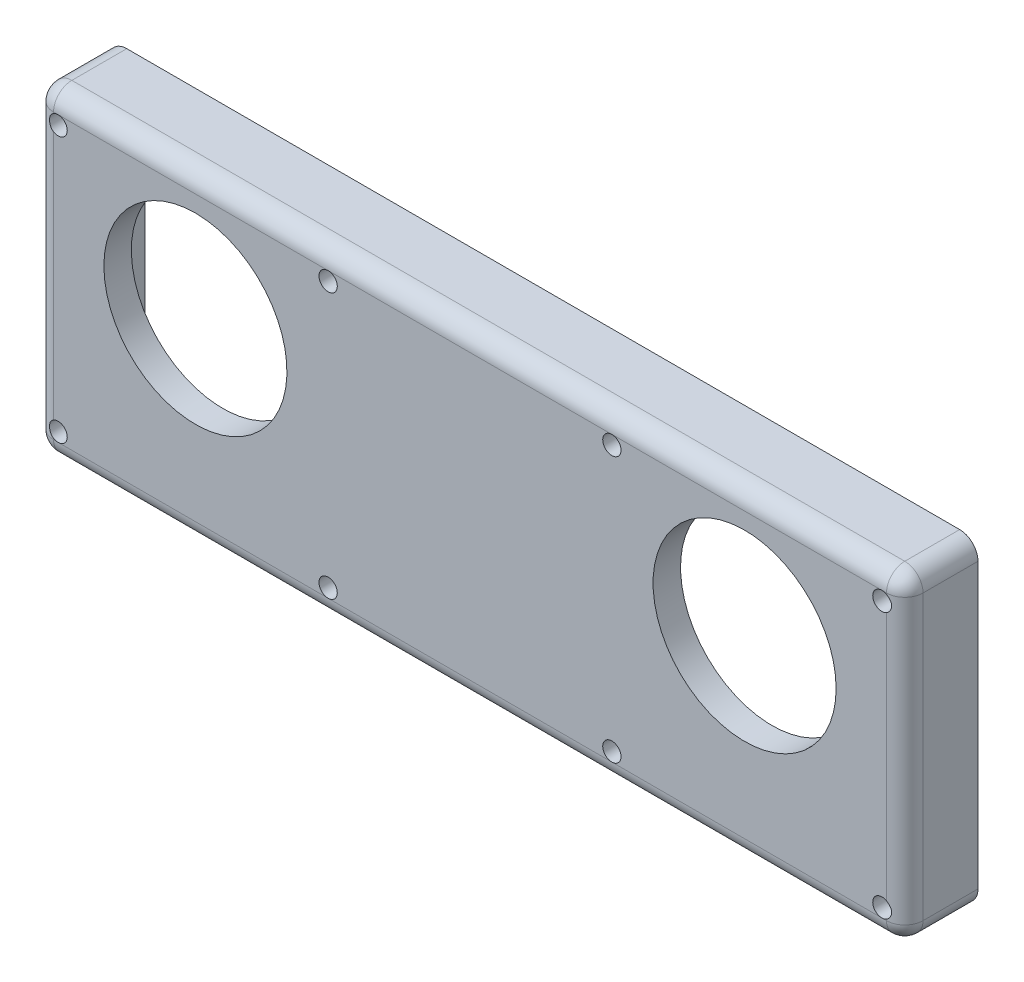
from build123d import *
from build123d.topology import SkipClean

# Parameters (mm, degrees)
SKETCH2_W           = 93
SKETCH2_H           = 32
SKETCH2_R           = 1
BOSS_EXTRUDE1_DEPTH = 3
SKETCH6_W           = 95
SKETCH6_H           = 35
SKETCH6_W_2         = 93
SKETCH6_H_2         = 32
BOSS_EXTRUDE2_DEPTH = 3
SKETCH8_W           = 95
SKETCH8_H           = 0.708642827
CUT_EXTRUDE6_DEPTH  = 10
SKETCH9_W           = 95
SKETCH9_H           = 0.71
BOSS_EXTRUDE3_DEPTH = 3
SKETCH10_R          = 10
CUT_EXTRUDE7_DEPTH  = 10
BOSS_EXTRUDE7_START = 5
SKETCH11_W          = 95
SKETCH11_H          = 35.001357173
SKETCH11_R          = 1
BOSS_EXTRUDE7_DEPTH = 5
FILLET1_R           = 2
FILLET2_R           = 2
CUT_EXTRUDE9_DEPTH  = 2


# Some blends are built 0.0001 mm under size
with BuildPart() as part:
    # Sketch2 → Boss-Extrude1 (new body)
    with BuildSketch(Plane.XY):
        with Locations((-12.642912006, 28.831434421)):
            Rectangle(SKETCH2_W, SKETCH2_H)
        with Locations((-57.642912006, 43.331434421)):
            Circle(SKETCH2_R, mode=Mode.SUBTRACT)
        with Locations((-57.642912006, 14.331434421)):
            Circle(SKETCH2_R, mode=Mode.SUBTRACT)
        with Locations((-28.142912006, 43.331434421)):
            Circle(SKETCH2_R, mode=Mode.SUBTRACT)
        with Locations((2.857087994, 43.331434421)):
            Circle(SKETCH2_R, mode=Mode.SUBTRACT)
        with Locations((2.857087994, 14.331434421)):
            Circle(SKETCH2_R, mode=Mode.SUBTRACT)
        with Locations((-28.142912006, 14.331434421)):
            Circle(SKETCH2_R, mode=Mode.SUBTRACT)
        with Locations((32.357087994, 14.331434421)):
            Circle(SKETCH2_R, mode=Mode.SUBTRACT)
        with Locations((32.357087994, 43.331434421)):
            Circle(SKETCH2_R, mode=Mode.SUBTRACT)
    extrude(amount=BOSS_EXTRUDE1_DEPTH)

    # Sketch6 → Boss-Extrude2 (add)
    with BuildSketch(Plane.XY.offset(3)):
        with Locations((-12.642912006, 29.540077248)):
            Rectangle(SKETCH6_W, SKETCH6_H)
        with Locations((-12.642912006, 28.831434421)):
            Rectangle(SKETCH6_W_2, SKETCH6_H_2, mode=Mode.SUBTRACT)
    extrude(amount=-BOSS_EXTRUDE2_DEPTH)

    # Sketch8 → Cut-Extrude6 (cut)
    with BuildSketch(Plane(origin=(0, 0, 0), x_dir=(-1, 0, 0), z_dir=(0, 0, -1))):
        with Locations((12.642912006, 46.685755835)):
            Rectangle(SKETCH8_W, SKETCH8_H)
    extrude(amount=-CUT_EXTRUDE6_DEPTH, mode=Mode.SUBTRACT)

    # Sketch9 → Boss-Extrude3 (add)
    with BuildSketch(Plane.XY.offset(3)):
        with Locations((-12.642912006, 11.685077248)):
            Rectangle(SKETCH9_W, SKETCH9_H)
    extrude(amount=-BOSS_EXTRUDE3_DEPTH)

    # Sketch10 → Cut-Extrude7 (cut)
    with BuildSketch(Plane.XY.offset(3)):
        with Locations((17.357087994, 32.531434421)):
            Circle(SKETCH10_R)
    cut_extrude7 = extrude(amount=-CUT_EXTRUDE7_DEPTH, mode=Mode.SUBTRACT)

    # Sketch11 → Boss-Extrude7 (add)
    with SkipClean():  # the faces are left unmerged after this step: merging them gives an invalid solid
        with BuildSketch(Plane(origin=(0, 0, 0), x_dir=(-1, 0, 0), z_dir=(0, 0, -1)).offset(BOSS_EXTRUDE7_START)):
            with Locations((12.642912006, 28.830755835)):
                Rectangle(SKETCH11_W, SKETCH11_H)
            with BuildLine():
                Line((-30.857087994, 41.830755835), (-21.034399682, 41.830755835))
                ThreePointArc((-21.034399682, 41.830755835), (-17.357087994, 42.531434421), (-13.679776305, 41.830755835))
                Line((-13.679776305, 41.830755835), (56.142912006, 41.830755835))
                Line((56.142912006, 41.830755835), (56.142912006, 15.830755835))
                Line((56.142912006, 15.830755835), (-30.857087994, 15.830755835))
                Line((-30.857087994, 15.830755835), (-30.857087994, 41.830755835))
            make_face(mode=Mode.SUBTRACT)
            with Locations((-32.357087994, 14.331434421)):
                Circle(SKETCH11_R, mode=Mode.SUBTRACT)
            with Locations((-2.857087994, 14.331434421)):
                Circle(SKETCH11_R, mode=Mode.SUBTRACT)
            with Locations((28.142912006, 14.331434421)):
                Circle(SKETCH11_R, mode=Mode.SUBTRACT)
            with Locations((-32.357087994, 43.331434421)):
                Circle(SKETCH11_R, mode=Mode.SUBTRACT)
            with Locations((28.142912006, 43.331434421)):
                Circle(SKETCH11_R, mode=Mode.SUBTRACT)
            with Locations((57.642912006, 43.331434421)):
                Circle(SKETCH11_R, mode=Mode.SUBTRACT)
            with Locations((57.642912006, 14.331434421)):
                Circle(SKETCH11_R, mode=Mode.SUBTRACT)
            with Locations((-2.857087994, 43.331434421)):
                Circle(SKETCH11_R, mode=Mode.SUBTRACT)
        extrude(amount=-BOSS_EXTRUDE7_DEPTH)

    # Fillet1
    fillet1_edges = [part.edges().sort_by_distance(p)[0] for p in [
        (-60.142912006, 46.331434421, -2.5),
        (34.857087994, 46.331434421, -2.5),
        (-12.642912006, 46.331434421, 3),
        (-12.642912006, 11.330077248, 3),
        (-60.142912006, 11.330077248, -2.5),
        (34.857087994, 11.330077248, -2.5),
    ]]
    fillet(fillet1_edges, radius=FILLET1_R - 0.0001)  # a hair under: the kernel refuses the full size

    # Fillet2
    # the kernel refuses this fillet: 2 mm, written as the material it takes off along each edge
    with BuildSketch(Plane(origin=(-58.142912006, 11.330077248, 1), x_dir=(0, 0, 1), z_dir=(1, 0, 0))) as fillet2_piece_1:
        with BuildLine():
            CenterArc((0.0001, -1.9999), 1.9999, 0, 90)
            Line((2, -1.9999), (2, 0))
            Line((2, 0), (0.0001, 0))
        make_face()
    revolve(axis=Axis((-58.142912006, 11.330077248, 1), (0, -1, 0)), revolution_arc=90, mode=Mode.SUBTRACT)
    with BuildSketch(Plane(origin=(32.857087994, 11.330077248, 1), x_dir=(1, 0, 0), z_dir=(0, 0, -1))) as fillet2_piece_2:
        with BuildLine():
            CenterArc((0.0001, -1.9999), 1.9999, 0, 90)
            Line((2, -1.9999), (2, 0))
            Line((2, 0), (0.0001, 0))
        make_face()
    revolve(axis=Axis((32.857087994, 11.330077248, 1), (0, -1, 0)), revolution_arc=90, mode=Mode.SUBTRACT)
    with BuildSketch(Plane(origin=(32.857087994, 46.331434421, 1), x_dir=(0, 0, 1), z_dir=(-1, 0, 0))) as fillet2_piece_3:
        with BuildLine():
            CenterArc((0.0001, -1.9999), 1.9999, 0, 90)
            Line((2, -1.9999), (2, 0))
            Line((2, 0), (0.0001, 0))
        make_face()
    revolve(axis=Axis((32.857087994, 46.331434421, 1), (0, 1, 0)), revolution_arc=90, mode=Mode.SUBTRACT)
    with BuildSketch(Plane(origin=(-58.142912006, 46.331434421, 1), x_dir=(-1, 0, 0), z_dir=(0, 0, -1))) as fillet2_piece_4:
        with BuildLine():
            CenterArc((0.0001, -1.9999), 1.9999, 0, 90)
            Line((2, -1.9999), (2, 0))
            Line((2, 0), (0.0001, 0))
        make_face()
    revolve(axis=Axis((-58.142912006, 46.331434421, 1), (0, 1, 0)), revolution_arc=90, mode=Mode.SUBTRACT)
    with BuildSketch(Plane(origin=(34.857087994, 11.330077248, 3), x_dir=(-1, 0, 0), z_dir=(0, 1, 0)), Plane(origin=(-60.142912006, 46.331434421, 3), x_dir=(1, 0, 0), z_dir=(0, -1, 0))) as fillet2_piece_5:
        with BuildLine():
            CenterArc((FILLET2_R, -FILLET2_R), FILLET2_R, 90, 90)
            Line((0, -FILLET2_R), (0, 0))
            Line((0, 0), (FILLET2_R, 0))
        make_face()
    extrude(amount=35.001357174, mode=Mode.SUBTRACT)

    # Mirror1: Cut-Extrude7 across plane
    add(cut_extrude7.mirror(Plane.ZY.offset(12.642912006)), mode=Mode.SUBTRACT)

    # Sketch13 → Cut-Extrude9 (cut)
    with BuildSketch(Plane(origin=(0, 0, -5), x_dir=(-1, 0, 0), z_dir=(0, 0, -1))):
        with BuildLine():
            Line((-5.755326065, 13.107203997), (-4.691817738, 13.107203997))
            ThreePointArc((-4.691817738, 13.107203997), (-2.755326065, 11.607203997), (-0.818834392, 13.107203997))
            Line((-0.818834392, 13.107203997), (0.244673935, 13.107203997))
            Line((0.244673935, 13.107203997), (0.244673935, 14.107203997))
            Line((0.244673935, 14.107203997), (-0.818834392, 14.107203997))
            ThreePointArc((-0.818834392, 14.107203997), (-2.755326065, 15.607203997), (-4.691817738, 14.107203997))
            Line((-4.691817738, 14.107203997), (-5.755326065, 14.107203997))
            Line((-5.755326065, 14.107203997), (-5.755326065, 13.107203997))
        make_face()
        with BuildLine():
            Line((25.041150078, 13.107203997), (25.041150078, 14.107203997))
            Line((25.041150078, 14.107203997), (26.104658405, 14.107203997))
            ThreePointArc((26.104658405, 14.107203997), (28.041150078, 15.607203997), (29.977641751, 14.107203997))
            Line((29.977641751, 14.107203997), (31.041150078, 14.107203997))
            Line((31.041150078, 14.107203997), (31.041150078, 13.107203997))
            Line((31.041150078, 13.107203997), (29.977641751, 13.107203997))
            ThreePointArc((29.977641751, 13.107203997), (28.041150078, 11.607203997), (26.104658405, 13.107203997))
            Line((26.104658405, 13.107203997), (25.041150078, 13.107203997))
        make_face()
    extrude(amount=-CUT_EXTRUDE9_DEPTH, mode=Mode.SUBTRACT)


solid = part.part
